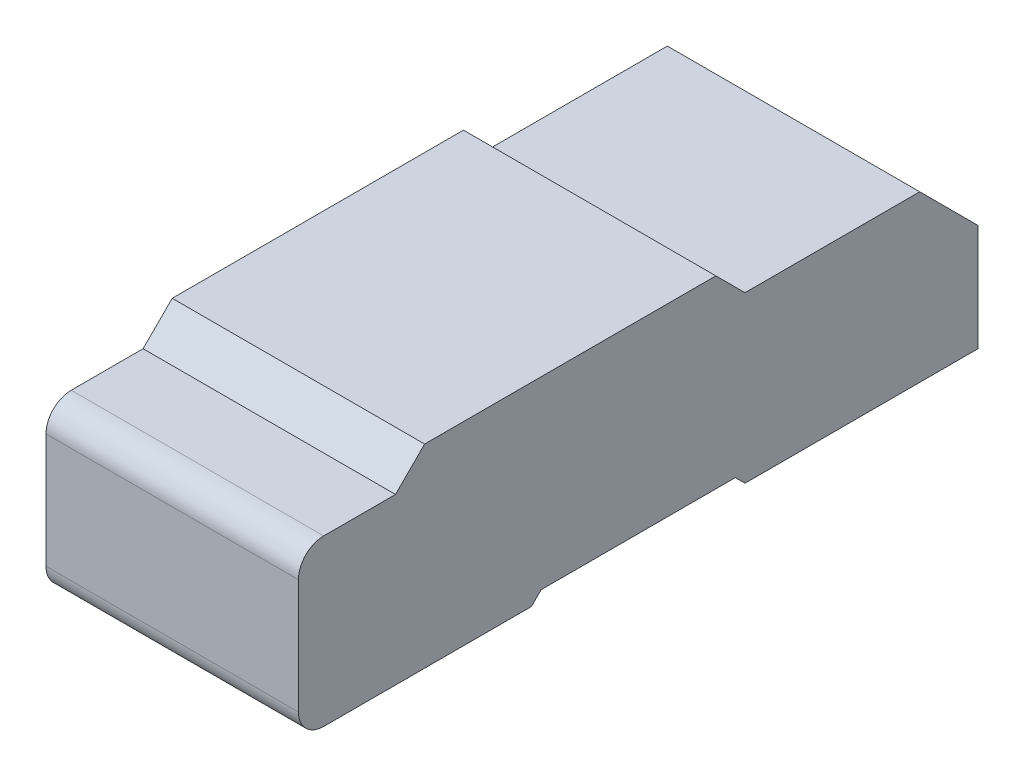
from build123d import *

# Parameters (mm, degrees)
BOSS_EXTRUDE1_DEPTH = 130
FILLET1_R           = 13


with BuildPart() as part:
    # Sketch2 → Boss-Extrude1 (new body)
    with BuildSketch(Plane(origin=(0, 0, 0), x_dir=(0, 0, -1), z_dir=(1, 0, 0))):
        Polygon((0, 0), (0, 85), (50, 85), (65, 100), (215, 100), (230, 85), (320, 85), (350, 55), (350, 0), (230, 0), (225, 5), (125, 5), (120, 0), align=None)
    extrude(amount=BOSS_EXTRUDE1_DEPTH)

    # Fillet1
    fillet1_edges = [part.edges().sort_by_distance(p)[0] for p in [
        (65, 0, 0),
        (65, 85, 0),
    ]]
    fillet(fillet1_edges, radius=FILLET1_R)


solid = part.part
